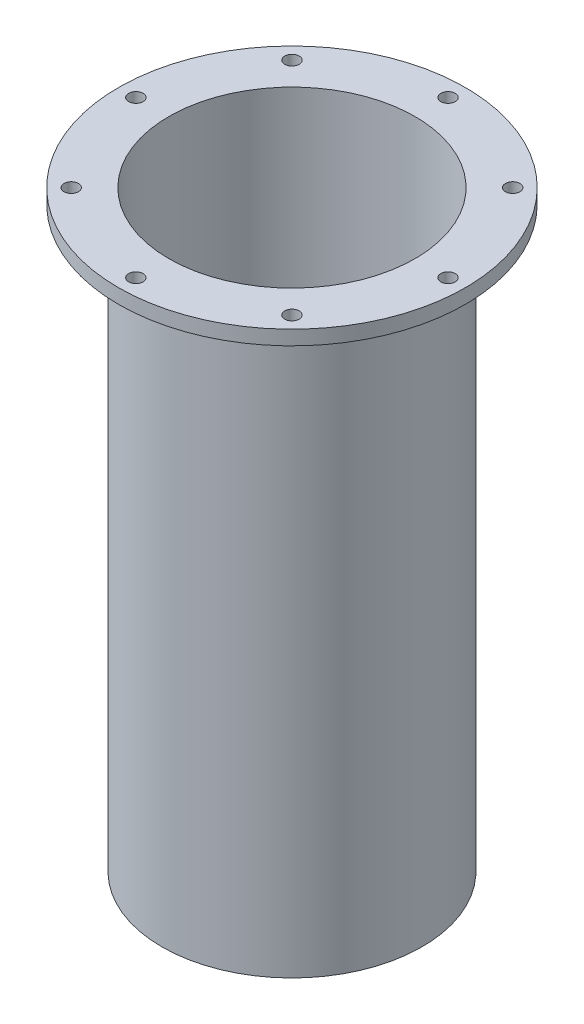
from build123d import *

# Parameters (mm, degrees)
SKETCH1_R                = 57.15
SKETCH1_R_2              = 54.102
SCHEDULED_CHAMBER_DEPTH  = 260.35
SKETCH2_R                = 76.2
SKETCH2_R_2              = 54.102
FLANGE_DEPTH             = 6.35
ORIGINAL_BOLT_HOLE_REACH = 283.771
SKETCH3_R                = 3.175
BOLT_HOLE_PATTERN_COUNT  = 8


with BuildPart() as part:
    # Sketch1 → Scheduled Chamber (new body)
    with BuildSketch(Plane(origin=(0, 0, 0), x_dir=(1, 0, 0), z_dir=(0, 1, 0))):
        Circle(SKETCH1_R)
        Circle(SKETCH1_R_2, mode=Mode.SUBTRACT)
    extrude(amount=-SCHEDULED_CHAMBER_DEPTH)

    # Sketch2 → Flange (add)
    with BuildSketch(Plane(origin=(0, 0, 0), x_dir=(1, 0, 0), z_dir=(0, 1, 0))):
        Circle(SKETCH2_R)
        Circle(SKETCH2_R_2, mode=Mode.SUBTRACT)
    extrude(amount=-FLANGE_DEPTH)

    # Sketch3 → Original Bolt Hole (cut, up to next)
    with BuildSketch(Plane(origin=(0, 0, 0), x_dir=(1, 0, 0), z_dir=(0, 1, 0)), mode=Mode.PRIVATE) as original_bolt_hole_sk1:
        with Locations((0, 68.58)):
            Circle(SKETCH3_R)
    original_bolt_hole_tool1 = extrude(original_bolt_hole_sk1.sketch, amount=-ORIGINAL_BOLT_HOLE_REACH, mode=Mode.PRIVATE) & part.part
    original_bolt_hole = original_bolt_hole_tool1.solids().sort_by_distance((0, 0, -68.58))[0]
    add(original_bolt_hole, mode=Mode.SUBTRACT)

    # Bolt Hole Pattern: Original Bolt Hole ×8 about axis
    bolt_hole_pattern_axis = Axis((0, 55, 0), (0, -1, 0))
    for i in range(1, BOLT_HOLE_PATTERN_COUNT):
        add(original_bolt_hole.rotate(bolt_hole_pattern_axis, i * 360 / BOLT_HOLE_PATTERN_COUNT), mode=Mode.SUBTRACT)


solid = part.part
